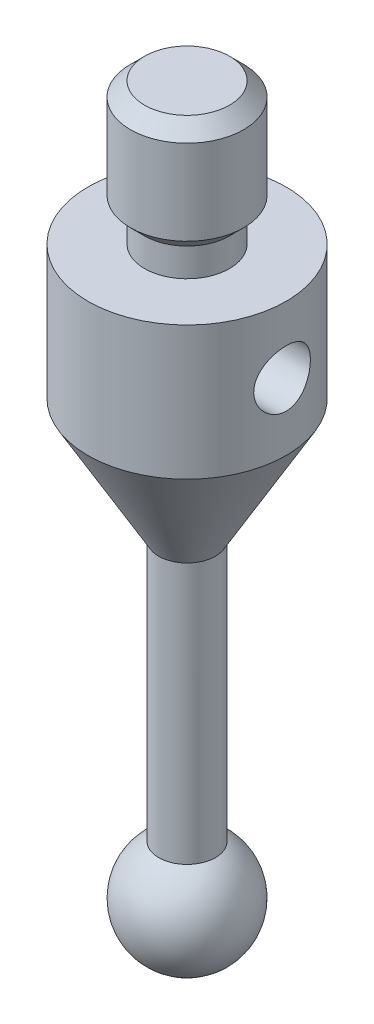
from build123d import *

# Parameters (mm, degrees)
SKETCH2_R               = 1
BOSS_EXTRUDE2_DEPTH     = 10
SKETCH4_R               = 3.5
BOSS_EXTRUDE3_DEPTH     = 10
CHAMFER1_SIZE           = 5.282754963
CHAMFER1_SIZE_2         = 3.05
CUT_EXTRUDE4_DEPTH      = 21.603397778
CUT_EXTRUDE4_DEPTH_BACK = 21.603397778
SKETCH5_R               = 1
SKETCH6_R               = 1.5
BOSS_EXTRUDE4_DEPTH     = 1
SKETCH7_R               = 2
BOSS_EXTRUDE5_DEPTH     = 4
CHAMFER2_SIZE           = 0.5


# Some blends are built 0.0001 mm under size
with BuildPart() as part:
    # Sketch1 → Revolve1 (revolve)
    with BuildSketch(Plane.XY):
        with BuildLine():
            Line((0, 0), (0, -2))
            ThreePointArc((0, -2), (2, 0), (0, 2))
            Line((0, 2), (0, 0))
        make_face()
    revolve(axis=Axis((0, 0, 0), (0, 1, 0)))

    # Sketch2 → Boss-Extrude2 (add)
    with BuildSketch(Plane(origin=(0, 0, 0), x_dir=(1, 0, 0), z_dir=(0, 1, 0))):
        with Locations(Location((0, 0, 0), (0, 0, 90))):
            Circle(SKETCH2_R)
    extrude(amount=BOSS_EXTRUDE2_DEPTH)

    # Sketch4 → Boss-Extrude3 (add)
    with BuildSketch(Plane(origin=(0, 10, 0), x_dir=(1, 0, 0), z_dir=(0, 1, 0))):
        with Locations(Location((0, 0, 0), (0, 0, 270))):
            Circle(SKETCH4_R)
    extrude(amount=BOSS_EXTRUDE3_DEPTH)

    # Chamfer1
    # the kernel refuses this chamfer: 5.282754963, 3.05 mm, written as the material it takes off along each edge
    with BuildSketch(Plane(origin=(0, 10, 0), x_dir=(0, 0, 1), z_dir=(-1, 0, 0))) as chamfer1_piece_1_section:
        Polygon((3.5, CHAMFER1_SIZE), (3.5 - CHAMFER1_SIZE_2, 0), (3.5, 0), align=None)
    chamfer1_piece_1 = revolve(axis=Axis((0, 10, 0), (0, 1, 0)), mode=Mode.PRIVATE)
    chamfer1_piece_1 = chamfer1_piece_1 - Plane(origin=(0, 13.183046822, 0), x_dir=(0, 0, -1), z_dir=(0, -1, 0)) * Cylinder(1, 22, mode=Mode.PRIVATE)
    add(chamfer1_piece_1, mode=Mode.SUBTRACT)

    # Sketch5 → Cut-Extrude4 (cut, two sides: drawn at the far end of the back side and taken through both)
    with BuildSketch(Plane(origin=(0, 0, 0), x_dir=(0, 0, -1), z_dir=(1, 0, 0)).offset(-CUT_EXTRUDE4_DEPTH_BACK)):
        with Locations((0, 17.641377482)):
            Circle(SKETCH5_R)
    extrude(amount=CUT_EXTRUDE4_DEPTH + CUT_EXTRUDE4_DEPTH_BACK, mode=Mode.SUBTRACT)

    # Sketch6 → Boss-Extrude4 (add)
    with BuildSketch(Plane(origin=(0, 20, 0), x_dir=(1, 0, 0), z_dir=(0, 1, 0))):
        with Locations(Location((0, 0, 0), (0, 0, 270))):
            Circle(SKETCH6_R)
    extrude(amount=BOSS_EXTRUDE4_DEPTH)

    # Sketch7 → Boss-Extrude5 (add)
    with BuildSketch(Plane(origin=(0, 21, 0), x_dir=(1, 0, 0), z_dir=(0, 1, 0))):
        with Locations(Location((0, 0, 0), (0, 0, 270))):
            Circle(SKETCH7_R)
    extrude(amount=BOSS_EXTRUDE5_DEPTH)

    # Chamfer2
    chamfer2_edges = [part.edges().sort_by_distance(p)[0] for p in [
        (0, 21, -2),
        (0, 25, -2),
    ]]
    chamfer(chamfer2_edges, length=CHAMFER2_SIZE - 0.0001)  # a hair under: the kernel refuses the full size


solid = part.part
